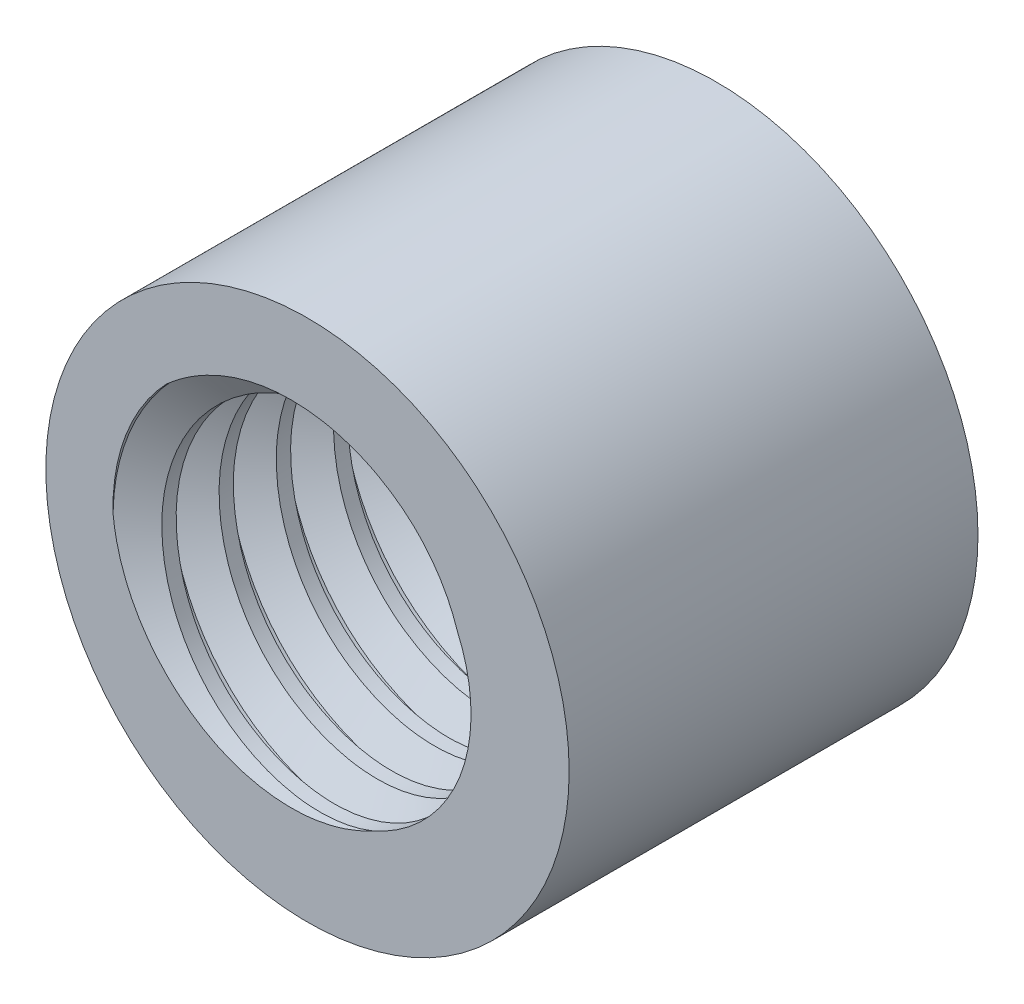
from build123d import *

# Parameters (mm, degrees)
SKETCH1_R           = 3.2
SKETCH1_R_2         = 2
BOSS_EXTRUDE1_DEPTH = 5
THREAD1_PITCH       = 0.7


with BuildPart() as part:
    # Sketch1 → Boss-Extrude1 (new body)
    with BuildSketch(Plane.XY):
        Circle(SKETCH1_R)
        Circle(SKETCH1_R_2, mode=Mode.SUBTRACT)
    extrude(amount=BOSS_EXTRUDE1_DEPTH)

    # Thread1: the profile of Thread Profile1 profile screwed along a right-hand helix of 14.285714 turns, 6 arcs to a turn; built about Z, then put on its axis
    thread1_z = Axis((0, 0, 0), (0, 0, 1))
    thread1_corners = [(1.9997, -1e-09, -0.000173205), (2.378886113, -1e-09, 0.218749999), (2.378886113, -1e-09, 0.306249999), (1.9997, -1e-09, 0.525173203)]
    with BuildLine(mode=Mode.PRIVATE) as thread1_profile:
        Line(thread1_corners[0], thread1_corners[1])
        Line(thread1_corners[1], thread1_corners[2])
        Line(thread1_corners[2], thread1_corners[3])
        Line(thread1_corners[3], thread1_corners[0])
    thread1_cap = Face(thread1_profile.wire())
    thread1_turn_angles = [0, 30, 60, 90, 120, 150, 180, 210, 240, 270, 300, 330, 360]
    thread1_turn_weights = [1, 0.8660254037844387, 1, 0.8660254037844387, 1, 0.8660254037844387, 1, 0.8660254037844387, 1, 0.8660254037844387, 1, 0.8660254037844387, 1]
    thread1_turn_rails = [Edge.make_bspline([Vector(p[0], p[1], 0).rotate(thread1_z, thread1_turn_angles[k]) / thread1_turn_weights[k] + Vector(0, 0, p[2] + THREAD1_PITCH * thread1_turn_angles[k] / 360) for k in range(13)], [0, 0, 0, 1, 1, 2, 2, 3, 3, 4, 4, 5, 5, 6, 6, 6], 2, thread1_turn_weights) for p in thread1_corners]
    thread1_turn_sides = [Face.make_surface_from_curves(thread1_turn_rails[p[0]], thread1_turn_rails[p[1]]) for p in [(0, 1), (1, 2), (2, 3), (3, 0)]]
    thread1_last_angles = [5040, 5070, 5100, 5121.428571429, 5142.857142857]
    thread1_last_weights = [1, 0.8660254037844387, 1, 0.9308737486442035, 1]
    thread1_last_rails = [Edge.make_bspline([Vector(p[0], p[1], 0).rotate(thread1_z, thread1_last_angles[k]) / thread1_last_weights[k] + Vector(0, 0, p[2] + THREAD1_PITCH * thread1_last_angles[k] / 360) for k in range(5)], [0, 0, 0, 1, 1, 2, 2, 2], 2, thread1_last_weights) for p in thread1_corners]
    thread1_last_sides = [Face.make_surface_from_curves(thread1_last_rails[p[0]], thread1_last_rails[p[1]]) for p in [(0, 1), (1, 2), (2, 3), (3, 0)]]
    thread1 = Plane(origin=(0, 0, 6), x_dir=(-0.999390827, 0.034899497, 0), z_dir=(0, 0, -1)) * Solid(Shell([*[p.moved(Location((0, 0, THREAD1_PITCH * i))) for i in range(14) for p in thread1_turn_sides], *thread1_last_sides, thread1_cap, thread1_cap.rotate(thread1_z, 5142.857142857).moved(Location((0, 0, THREAD1_PITCH * 5142.857142857 / 360)))]))
    add(thread1, mode=Mode.SUBTRACT)


solid = part.part
